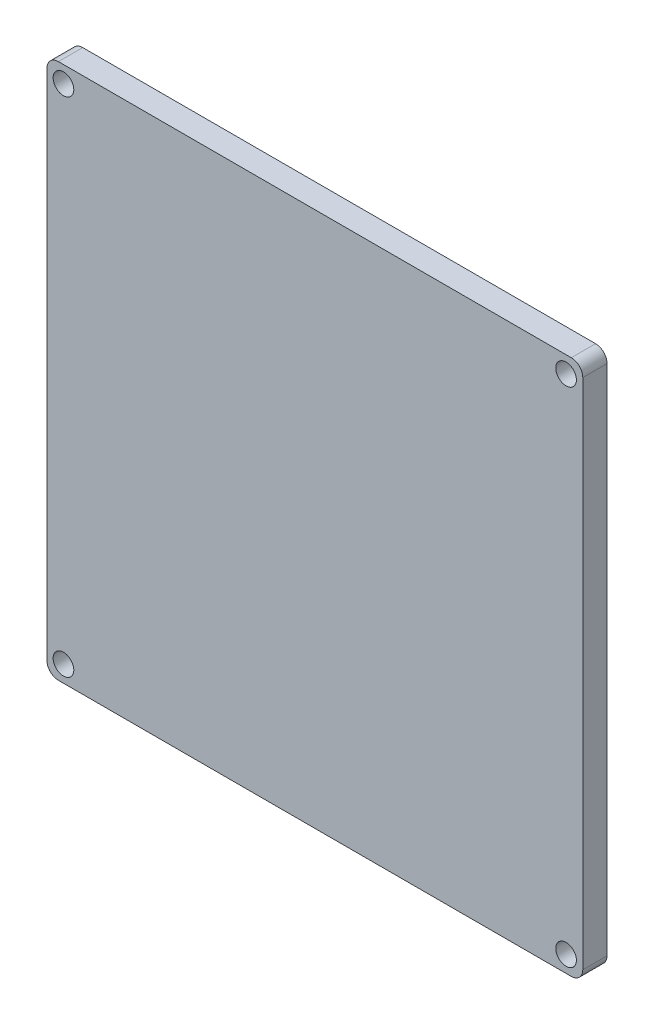
from build123d import *

# Parameters (mm, degrees)
SKETCH1_W           = 70
SKETCH1_H           = 70
SKETCH1_R           = 1.35
BOSS_EXTRUDE1_DEPTH = 3.175
FILLET1_R           = 1.5


with BuildPart() as part:
    # Sketch1 → Boss-Extrude1 (new body)
    with BuildSketch(Plane.XY):
        Rectangle(SKETCH1_W, SKETCH1_H)
        with Locations((-32.84, 32.82)):
            Circle(SKETCH1_R, mode=Mode.SUBTRACT)
        with Locations((-32.84, -32.84)):
            Circle(SKETCH1_R, mode=Mode.SUBTRACT)
        with Locations((32.82, -32.84)):
            Circle(SKETCH1_R, mode=Mode.SUBTRACT)
        with Locations((32.82, 32.82)):
            Circle(SKETCH1_R, mode=Mode.SUBTRACT)
    extrude(amount=BOSS_EXTRUDE1_DEPTH)

    # Fillet1
    fillet1_edges = [part.edges().sort_by_distance(p)[0] for p in [
        (35, 35, 1.5875),
        (35, -35, 1.5875),
        (-35, -35, 1.5875),
        (-35, 35, 1.5875),
    ]]
    fillet(fillet1_edges, radius=FILLET1_R)


solid = part.part
